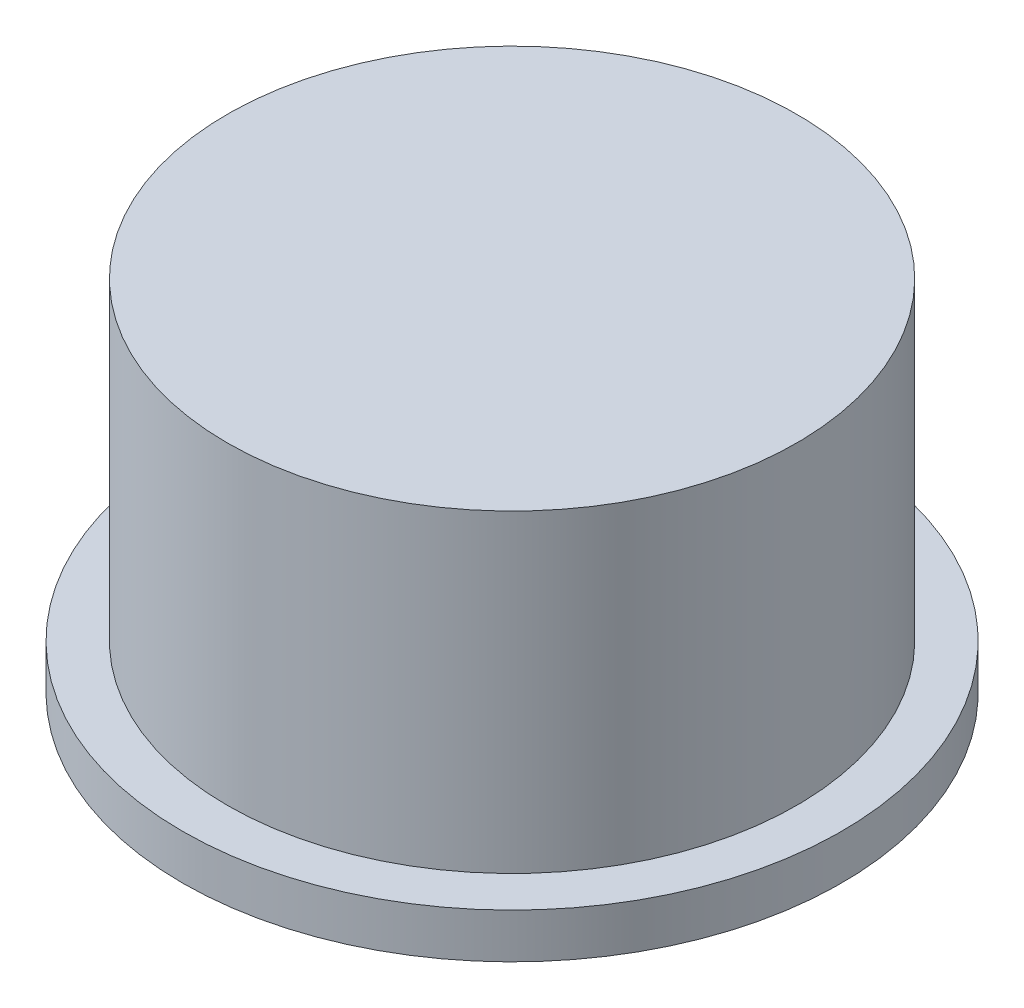
from build123d import *

# Parameters (mm, degrees)
SKETCH1_R           = 6.35
BOSS_EXTRUDE1_DEPTH = 8
SKETCH1_3_R         = 7.35
SKETCH1_3_R_2       = 6.35
BOSS_EXTRUDE2_DEPTH = 1


with BuildPart() as part:
    # Sketch1 → Boss-Extrude1 (new body)
    with BuildSketch(Plane(origin=(0, 0, 0), x_dir=(1, 0, 0), z_dir=(0, 1, 0))):
        Circle(SKETCH1_R)
    extrude(amount=BOSS_EXTRUDE1_DEPTH)

    # Sketch1<3> → Boss-Extrude2 (add)
    with BuildSketch(Plane(origin=(0, 0, 0), x_dir=(1, 0, 0), z_dir=(0, 1, 0))):
        Circle(SKETCH1_3_R)
        Circle(SKETCH1_3_R_2, mode=Mode.SUBTRACT)
    extrude(amount=BOSS_EXTRUDE2_DEPTH)

    # Sketch3 → Revolve1 (revolve)
    with BuildSketch(Plane.XY):
        with BuildLine():
            Line((0, -2), (0, 0))
            Line((0, 0), (-3.596294389, 0))
            ThreePointArc((-3.596294389, 0), (-2.057506582, -1.466366354), (0, -2))
        make_face()
    revolve(axis=Axis((0, 0, 0), (0, -1, 0)))


solid = part.part
